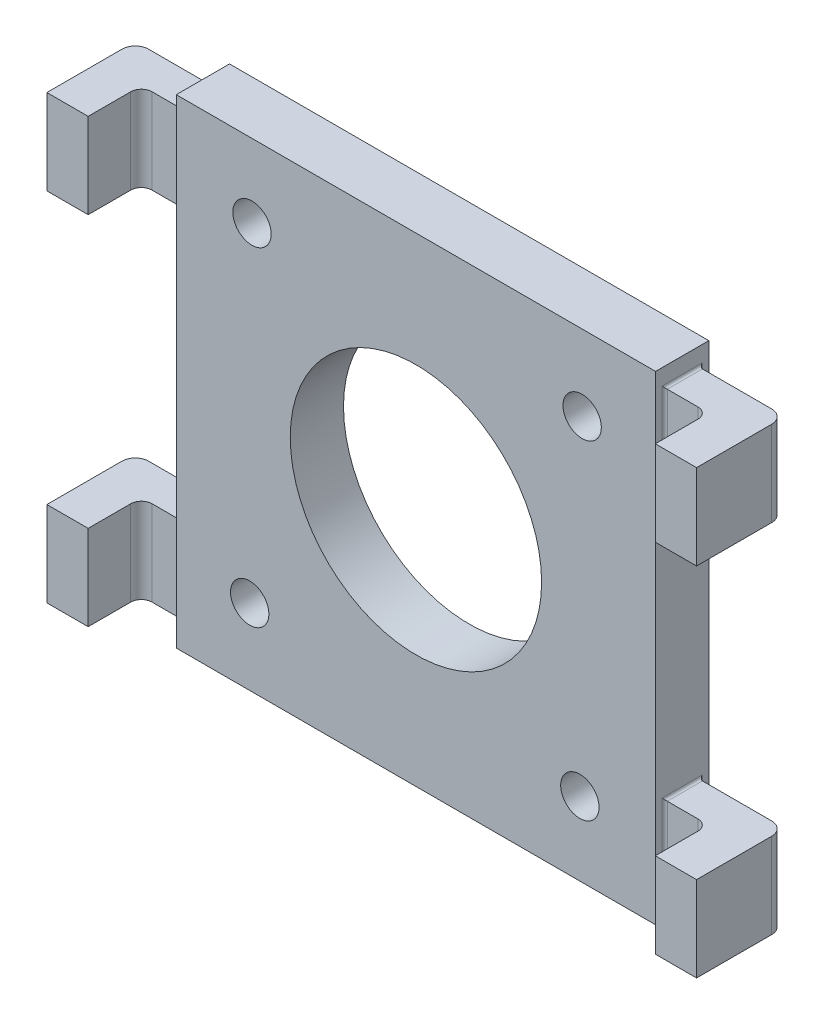
from build123d import *

# Parameters (mm, degrees)
SKETCH2_W           = 45
SKETCH2_H           = 45
SKETCH2_R           = 1.800000007
SKETCH2_R_2         = 1.800000008
SKETCH2_R_3         = 1.800000009
SKETCH2_R_4         = 11.8
BOSS_EXTRUDE1_DEPTH = 5
SKETCH3_W           = 3.3
SKETCH3_H           = 8
BOSS_EXTRUDE2_DEPTH = 8
FILLET1_R           = 0.25
SKETCH4_W           = 3.875
SKETCH4_H           = 8
BOSS_EXTRUDE3_DEPTH = 5
FILLET2_R           = 1
FILLET3_R           = 1.25
SKETCH5_W           = 3.3
SKETCH5_H           = 8
BOSS_EXTRUDE4_DEPTH = 8
FILLET4_R           = 0.25
SKETCH6_W           = 3.875
SKETCH6_H           = 8
BOSS_EXTRUDE5_DEPTH = 5
FILLET5_R           = 1
FILLET6_R           = 1.25


with BuildPart() as part:
    # Sketch2 → Boss-Extrude1 (new body)
    with BuildSketch(Plane.XY):
        with Locations((-1.875, 3e-09)):
            Rectangle(SKETCH2_W, SKETCH2_H)
        with Locations((-17.267123682, 15.607130691)):
            Circle(SKETCH2_R, mode=Mode.SUBTRACT)
        with Locations((-17.482130685, -15.392123684)):
            Circle(SKETCH2_R_2, mode=Mode.SUBTRACT)
        with Locations((13.517123689, -15.607130686)):
            Circle(SKETCH2_R_3, mode=Mode.SUBTRACT)
        with Locations((13.732130692, 15.392123688)):
            Circle(SKETCH2_R_2, mode=Mode.SUBTRACT)
        with Locations((-1.875, 3e-09)):
            Circle(SKETCH2_R_4, mode=Mode.SUBTRACT)
    extrude(amount=BOSS_EXTRUDE1_DEPTH)

    # Sketch3 → Boss-Extrude2 (add)
    with BuildSketch(Plane.ZY.offset(24.375)):
        with Locations((2.5, 16.750000003)):
            Rectangle(SKETCH3_W, SKETCH3_H)
        with Locations((2.5, -16.750000003)):
            Rectangle(SKETCH3_W, SKETCH3_H)
    extrude(amount=BOSS_EXTRUDE2_DEPTH)

    # Fillet1
    fillet1_edges = [part.edges().sort_by_distance(p)[0] for p in [
        (-24.375, 20.750000003, 2.5),
        (-24.375, -12.750000003, 2.5),
        (-24.375, -20.750000003, 2.5),
        (-24.375, -16.750000003, 0.85),
        (-24.375, 12.750000003, 2.5),
        (-24.375, 16.750000003, 0.85),
        (-24.375, 16.750000003, 4.15),
        (-24.375, -16.750000003, 4.15),
    ]]
    fillet(fillet1_edges, radius=FILLET1_R)

    # Sketch4 → Boss-Extrude3 (add)
    with BuildSketch(Plane.XY.offset(4.15)):
        with Locations((-30.4375, 16.750000003)):
            Rectangle(SKETCH4_W, SKETCH4_H)
        with Locations((-30.4375, -16.750000003)):
            Rectangle(SKETCH4_W, SKETCH4_H)
    extrude(amount=BOSS_EXTRUDE3_DEPTH)

    # Fillet2
    fillet2_edges = [part.edges().sort_by_distance(p)[0] for p in [
        (-28.5, -16.750000003, 4.15),
        (-28.5, 16.750000003, 4.15),
    ]]
    fillet(fillet2_edges, radius=FILLET2_R)

    # Fillet3
    fillet3_edges = [part.edges().sort_by_distance(p)[0] for p in [
        (-32.375, -16.750000003, 0.85),
        (-32.375, 16.750000003, 0.85),
    ]]
    fillet(fillet3_edges, radius=FILLET3_R)

    # Sketch5 → Boss-Extrude4 (add)
    with BuildSketch(Plane(origin=(20.625, 0, 0), x_dir=(0, 0, -1), z_dir=(1, 0, 0))):
        with Locations((-2.5, 16.750000003)):
            Rectangle(SKETCH5_W, SKETCH5_H)
        with Locations((-2.5, -16.750000003)):
            Rectangle(SKETCH5_W, SKETCH5_H)
    extrude(amount=BOSS_EXTRUDE4_DEPTH)

    # Fillet4
    fillet4_edges = [part.edges().sort_by_distance(p)[0] for p in [
        (20.625, -12.750000003, 2.5),
        (20.625, -16.750000003, 4.15),
        (20.625, -20.750000003, 2.5),
        (20.625, -16.750000003, 0.85),
        (20.625, 20.750000003, 2.5),
        (20.625, 12.750000003, 2.5),
        (20.625, 16.750000003, 0.85),
        (20.625, 16.750000003, 4.15),
    ]]
    fillet(fillet4_edges, radius=FILLET4_R)

    # Sketch6 → Boss-Extrude5 (add)
    with BuildSketch(Plane.XY.offset(4.15)):
        with Locations((26.6875, 16.750000003)):
            Rectangle(SKETCH6_W, SKETCH6_H)
        with Locations((26.6875, -16.750000003)):
            Rectangle(SKETCH6_W, SKETCH6_H)
    extrude(amount=BOSS_EXTRUDE5_DEPTH)

    # Fillet5
    fillet5_edges = [part.edges().sort_by_distance(p)[0] for p in [
        (24.75, -16.750000003, 4.15),
        (24.75, 16.750000003, 4.15),
    ]]
    fillet(fillet5_edges, radius=FILLET5_R)

    # Fillet6
    fillet6_edges = [part.edges().sort_by_distance(p)[0] for p in [
        (28.625, 16.750000003, 0.85),
        (28.625, -16.750000003, 0.85),
    ]]
    fillet(fillet6_edges, radius=FILLET6_R)


solid = part.part
